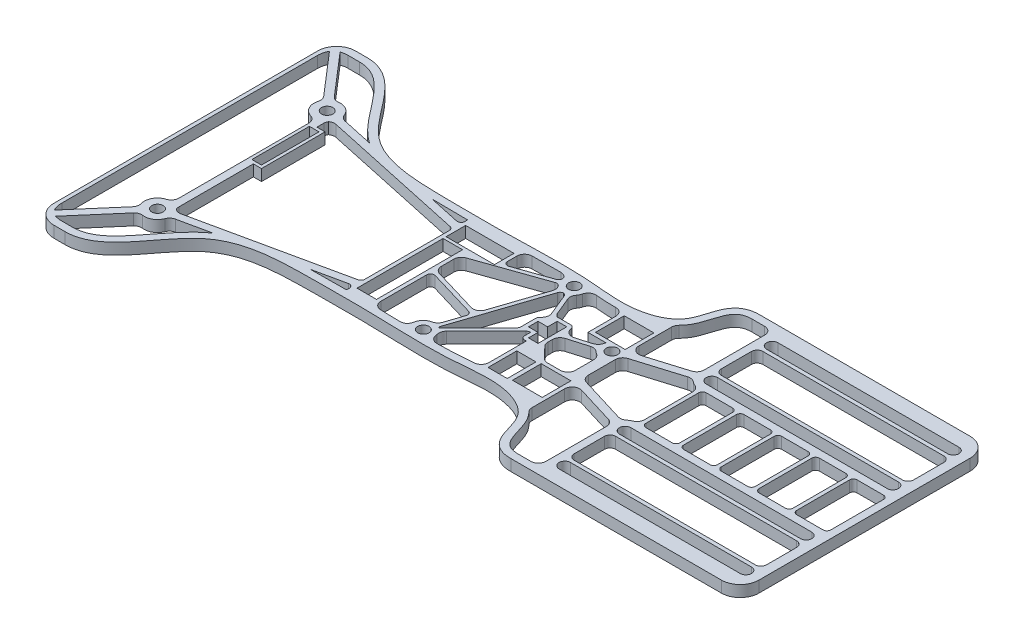
from build123d import *

# Parameters (mm, degrees)
SKETCH_1_W                = 180
SKETCH_1_H                = 150
EXTRUDE_5273_DEPTH        = 1.5
CUT_EXTRUDE_6960_DEPTH    = 118.192149908
CUT_EXTRUDE_8328_DEPTH    = 118.192149908
SKETCH_4_R                = 1.5
SKETCH_4_W                = 7.874
SKETCH_4_H                = 7.62
SKETCH_4_W_2              = 5.175
SKETCH_4_H_2              = 22.825
SKETCH_4_W_3              = 12.825
SKETCH_4_H_3              = 5.175
SKETCH_4_W_4              = 5.08
DMOTOR_DEPTH              = 118.192149908
SKETCH_5_R                = 1.5
SKETCH_5_W                = 2.55
SKETCH_5_H                = 15.25
LINELANCE_1_DEPTH         = 118.192149908
CUT_EXTRUDE_11814_DEPTH   = 118.192149908
CUT_EXTRUDE_1_DEPTH       = 99.534258137
CUT_EXTRUDE_2_DEPTH       = 99.534258137
CUT_EXTRUDE_2_DEPTH_BACK  = 99.534258137
CUT_EXTRUDE_START         = -3
CUT_EXTRUDE_3_OUTLINE_W   = 9
CUT_EXTRUDE_3_OUTLINE_H   = 16
CUT_EXTRUDE_3_OUTLINE_W_2 = 8.99992757
CUT_EXTRUDE_3_DEPTH       = 3
FILLET_START              = -1.5
FILLET_2_DEPTH            = 3
FILLET_START_2            = -2
FILLET_1_DEPTH            = 4
FILLET_1_2_DEPTH          = 3


with BuildPart() as part:
    # Эскиз1 → Extrude 5273 (new, symmetric)
    with BuildSketch(Plane(origin=(0, 0, 0), x_dir=(1, 0, 0), z_dir=(0, 1, 0))):
        Rectangle(SKETCH_1_W, SKETCH_1_H)
    extrude(amount=EXTRUDE_5273_DEPTH, both=True)

    # Эскиз2 → Cut-Extrude 6960 (cut, through all)
    with BuildSketch(Plane(origin=(0, 1.5, 0), x_dir=(1, 0, 0), z_dir=(0, 1, 0))):
        with BuildLine():
            ThreePointArc((86, 29), (87.5, 27.5), (86, 26))
            Line((86, 26), (38, 26))
            ThreePointArc((38, 26), (36.5, 27.5), (38, 29))
            Line((38, 29), (86, 29))
        make_face()
        with BuildLine():
            ThreePointArc((86, 13), (87.5, 11.5), (86, 10))
            Line((86, 10), (38, 10))
            ThreePointArc((38, 10), (36.5, 11.5), (38, 13))
            Line((38, 13), (86, 13))
        make_face()
        with BuildLine():
            ThreePointArc((38, -13), (36.5, -11.5), (38, -10))
            Line((38, -10), (86, -10))
            ThreePointArc((86, -10), (87.5, -11.5), (86, -13))
            Line((86, -13), (38, -13))
        make_face()
        with BuildLine():
            ThreePointArc((38, -29), (36.5, -27.5), (38, -26))
            Line((38, -26), (86, -26))
            ThreePointArc((86, -26), (87.5, -27.5), (86, -29))
            Line((86, -29), (38, -29))
        make_face()
        with BuildLine():
            ThreePointArc((36.5, 15.5), (38, 14), (39.5, 15.5))
            Line((39.5, 15.5), (39.5, 23.5))
            ThreePointArc((39.5, 23.5), (38, 25), (36.5, 23.5))
            Line((36.5, 23.5), (36.5, 15.5))
        make_face()
        with BuildLine():
            ThreePointArc((38, 25), (39.060660172, 24.560660172), (39.5, 23.5))
            Line((39.5, 23.5), (39.5, 15.5))
            ThreePointArc((39.5, 15.5), (39.060660172, 14.439339828), (38, 14))
            Line((38, 14), (86, 14))
            ThreePointArc((86, 14), (84.939339828, 14.439339828), (84.5, 15.5))
            Line((84.5, 15.5), (84.5, 23.5))
            ThreePointArc((84.5, 23.5), (84.939339828, 24.560660172), (86, 25))
            Line((86, 25), (38, 25))
        make_face()
        with BuildLine():
            ThreePointArc((84.5, 15.5), (86, 14), (87.5, 15.5))
            Line((87.5, 15.5), (87.5, 23.5))
            ThreePointArc((87.5, 23.5), (86, 25), (84.5, 23.5))
            Line((84.5, 23.5), (84.5, 15.5))
        make_face()
        with BuildLine():
            ThreePointArc((36.5, -15.5), (38, -14), (39.5, -15.5))
            Line((39.5, -15.5), (39.5, -23.5))
            ThreePointArc((39.5, -23.5), (38, -25), (36.5, -23.5))
            Line((36.5, -23.5), (36.5, -15.5))
        make_face()
        with BuildLine():
            Line((39.5, -15.5), (39.5, -23.5))
            ThreePointArc((39.5, -23.5), (39.060660172, -24.560660172), (38, -25))
            Line((38, -25), (86, -25))
            ThreePointArc((86, -25), (84.939339828, -24.560660172), (84.5, -23.5))
            Line((84.5, -23.5), (84.5, -15.5))
            ThreePointArc((84.5, -15.5), (84.939339828, -14.439339828), (86, -14))
            Line((86, -14), (38, -14))
            ThreePointArc((38, -14), (39.060660172, -14.439339828), (39.5, -15.5))
        make_face()
        with BuildLine():
            ThreePointArc((84.5, -15.5), (86, -14), (87.5, -15.5))
            Line((87.5, -15.5), (87.5, -23.5))
            ThreePointArc((87.5, -23.5), (86, -25), (84.5, -23.5))
            Line((84.5, -23.5), (84.5, -15.5))
        make_face()
    extrude(amount=-CUT_EXTRUDE_6960_DEPTH, mode=Mode.SUBTRACT)

    # Эскиз3 → Cut-Extrude 8328 (cut, through all)
    with BuildSketch(Plane(origin=(0, 1.5, 0), x_dir=(1, 0, 0), z_dir=(0, 1, 0))):
        with BuildLine():
            Line((27.5, 33), (85, 33))
            ThreePointArc((85, 33), (88.535533906, 31.535533906), (90, 28))
            Line((90, 28), (90, 75))
            Line((90, 75), (27.5, 75))
            Line((27.5, 75), (27.5, 33))
        make_face()
        with BuildLine():
            Line((90, -75), (90, -28))
            ThreePointArc((90, -28), (88.535533906, -31.535533906), (85, -33))
            Line((85, -33), (27.5, -33))
            Line((27.5, -33), (27.5, -75))
            Line((27.5, -75), (90, -75))
        make_face()
    extrude(amount=-CUT_EXTRUDE_8328_DEPTH, mode=Mode.SUBTRACT)

    # Эскиз4 → Вырез для DMotor (cut, through all)
    with BuildSketch(Plane(origin=(0, 1.5, 0), x_dir=(1, 0, 0), z_dir=(0, 1, 0))):
        with Locations(Location((-12, -15, 0), (0, 0, 270))):
            Circle(SKETCH_4_R)
        with Locations(Location((-2, 15, 0), (0, 0, 270))):
            Circle(SKETCH_4_R)
        with Locations(Location((18, 5, 0), (0, 0, 270))):
            Circle(SKETCH_4_R)
        with Locations((15.378, 11)):
            Rectangle(SKETCH_4_W, SKETCH_4_H)
        with Locations((15.378, -11)):
            Rectangle(SKETCH_4_W, SKETCH_4_H)
        Polygon((3.83, -0.43), (3.83, -2.97), (6.37, -2.97), (6.37, 4.65), (3.83, 4.65), (3.83, 2.11), (1.29, 2.11), (1.29, -0.43), align=None)
        with Locations((-27.7375, -2.8625)):
            Rectangle(SKETCH_4_W_2, SKETCH_4_H_2)
        with Locations((-23.9125, 11.9375)):
            Rectangle(SKETCH_4_W_3, SKETCH_4_H_3)
        with Locations((7.8, -11.3)):
            Rectangle(SKETCH_4_W_4, SKETCH_4_H)
    extrude(amount=-DMOTOR_DEPTH, mode=Mode.SUBTRACT)

    # Эскиз5 → Вырез для Linelance (1 плата) (cut, through all)
    with BuildSketch(Plane(origin=(0, 1.5, 0), x_dir=(1, 0, 0), z_dir=(0, 1, 0))):
        with Locations(Location((-75, 22.5, 0), (0, 0, 270))):
            Circle(SKETCH_5_R)
        with Locations(Location((-75, -22.5, 0), (0, 0, 270))):
            Circle(SKETCH_5_R)
        with Locations((-72.525, 8.95)):
            Rectangle(SKETCH_5_W, SKETCH_5_H)
    extrude(amount=-LINELANCE_1_DEPTH, mode=Mode.SUBTRACT)

    # Эскиз6 → Cut-Extrude 11814 (cut, through all)
    with BuildSketch(Plane(origin=(0, 1.5, 0), x_dir=(1, 0, 0), z_dir=(0, 1, 0))):
        with BuildLine():
            ThreePointArc((-90, 35), (-88.535533906, 38.535533906), (-85, 40))
            Line((-85, 40), (-82, 40))
            add(Edge.make_bspline(
                [(29.174696317, 33), (25.174443353, 33), (22.263039953, 29.095708265), (20.959201373, 21.044231044), (11.178424533, 16.661826251), (-2.912295004, 18.89849361), (-20.904097143, 17.963451349), (-40.921477826, 18.08537112), (-65.587592727, 18.693161196), (-72.397497435, 40), (-82, 40)],
                knots=[0, 0, 0, 0, 0.064919912, 0.117356941, 0.18302612, 0.292534606, 0.460869964, 0.611104745, 0.786597446, 1, 1, 1, 1], degree=3))
            Line((29.174696317, 33), (27.5, 33))
            Line((27.5, 33), (27.5, 75))
            Line((27.5, 75), (-90, 75))
            Line((-90, 75), (-90, 35))
        make_face()
        with BuildLine():
            ThreePointArc((-85, -40), (-88.535533906, -38.535533906), (-90, -35))
            Line((-90, -35), (-90, -75))
            Line((-90, -75), (27.5, -75))
            Line((27.5, -75), (27.5, -33))
            Line((27.5, -33), (29.174696317, -33))
            add(Edge.make_bspline(
                [(29.174696317, -33), (25.174443353, -33), (22.263039953, -29.095708265), (20.959201373, -21.044231044), (11.178424533, -16.661826251), (-2.912295004, -18.89849361), (-20.904097143, -17.963451349), (-40.921477826, -18.08537112), (-65.587592727, -18.693161196), (-72.397497435, -40), (-82, -40)],
                knots=[0, 0, 0, 0, 0.064919912, 0.117356941, 0.18302612, 0.292534606, 0.460869964, 0.611104745, 0.786597446, 1, 1, 1, 1], degree=3))
            Line((-82, -40), (-85, -40))
        make_face()
    extrude(amount=-CUT_EXTRUDE_11814_DEPTH, mode=Mode.SUBTRACT)

    # Эскиз7 → Вырез Облегчение 1 (cut, through all)
    with BuildSketch(Plane(origin=(0, 1.5, 0), x_dir=(1, 0, 0), z_dir=(0, 1, 0))):
        with BuildLine():
            Line((-8.902902115, -4.127567514), (-3.409755996, 12.351870843))
            ThreePointArc((-3.409755996, 12.351870843), (-4.102961295, 12.86047814), (-4.623439876, 13.544815057))
            Line((-4.623439876, 13.544815057), (-24.15, 6.659829298))
            Line((-24.15, 6.659829298), (-24.15, 0.426205922))
            Line((-24.15, 0.426205922), (-8.902902115, -4.127567514))
        make_face()
        with BuildLine():
            ThreePointArc((-1.336169855, 12.074366814), (-1.896788918, 12.001775947), (-2.461072698, 12.035643077))
            Line((-2.461072698, 12.035643077), (-10.590244004, -12.351870843))
            ThreePointArc((-10.590244004, -12.351870843), (-10.423209581, -12.447798602), (-10.262675499, -12.55424785))
            Line((-10.262675499, -12.55424785), (0.854549467, -1.43))
            Line((0.854549467, -1.43), (0.29, -1.43))
            Line((0.29, -1.43), (0.29, 3.11))
            Line((0.29, 3.11), (2.354667611, 3.11))
            Line((2.354667611, 3.11), (-1.336169855, 12.074366814))
        make_face()
        with BuildLine():
            Line((-11.538927302, -12.035643077), (-9.219287024, -5.076722242))
            Line((-9.219287024, -5.076722242), (-24.15, -0.617441883))
            Line((-24.15, -0.617441883), (-24.15, -15.275))
            Line((-24.15, -15.275), (-24.15, -16.092669036))
            add(Edge.make_bspline(
                [(-14.694642159, -16.318674955), (-15.987976916, -16.286222999), (-17.282914752, -16.248857872), (-19.874602584, -16.178155779), (-21.172389147, -16.145214053), (-23.028062557, -16.109985236), (-23.589238986, -16.100684905), (-24.15, -16.092669036)],
                knots=[0.406288882, 0.406288882, 0.406288882, 0.406288882, 0.4375, 0.4375, 0.46875, 0.46875, 0.482323343, 0.482323343, 0.482323343, 0.482323343], degree=3))
            ThreePointArc((-14.694642159, -16.318674955), (-14.415222278, -13.220477213), (-11.538927302, -12.035643077))
        make_face()
        with BuildLine():
            Line((-16.5, 10.417529619), (-4.955970451, 14.487907532))
            ThreePointArc((-4.955970451, 14.487907532), (-4.967263088, 15.441983898), (-4.678404128, 16.351351666))
            add(Edge.make_bspline(
                [(-4.678404128, 16.351351666), (-6.710548792, 16.414052135), (-8.756959257, 16.419356666), (-12.702430937, 16.371539821), (-14.600242226, 16.323034836), (-16.5, 16.270908805)],
                knots=[0.325241822, 0.325241822, 0.325241822, 0.325241822, 0.375, 0.375, 0.420804199, 0.420804199, 0.420804199, 0.420804199], degree=3))
            Line((-16.5, 16.270908805), (-16.5, 10.417529619))
        make_face()
        with BuildLine():
            ThreePointArc((0.820607877, 16.021846958), (0.835587409, 14.020487854), (-0.411478233, 12.455083774))
            Line((-0.411478233, 12.455083774), (2.83, 4.582128066))
            Line((2.83, 4.582128066), (2.83, 5.65))
            Line((2.83, 5.65), (7.37, 5.65))
            Line((7.37, 5.65), (7.37, 2.40036778))
            Line((7.37, 2.40036778), (15.020899439, 4.646503395))
            ThreePointArc((15.020899439, 4.646503395), (15.031433787, 5.433145055), (15.24611184, 6.19))
            Line((15.24611184, 6.19), (10.441, 6.19))
            Line((10.441, 6.19), (10.441, 15.704216945))
            add(Edge.make_bspline(
                [(10.441, 15.704216945), (9.847440479, 15.650577839), (9.258926549, 15.617782688), (7.286699457, 15.56254878), (5.928184506, 15.616617616), (3.314166167, 15.793575688), (2.056408073, 15.913942833), (0.820607877, 16.021846958)],
                knots=[0.205634931, 0.205634931, 0.205634931, 0.205634931, 0.21875, 0.21875, 0.25, 0.25, 0.280150338, 0.280150338, 0.280150338, 0.280150338], degree=3))
        make_face()
        with BuildLine():
            Line((2.268316694, -1.43), (-9.55534548, -13.261131323))
            ThreePointArc((-9.55534548, -13.261131323), (-9.006356142, -14.804816877), (-9.350255806, -16.406718062))
            add(Edge.make_bspline(
                [(4.26, -15.730331198), (3.046650052, -15.81800323), (1.85624768, -15.932163665), (0.045867473, -16.089018669), (-0.58554622, -16.14019059), (-1.850323322, -16.226139926), (-2.484465556, -16.261956101), (-5.182608062, -16.387077569), (-7.261528853, -16.415920139), (-9.350255806, -16.406718062)],
                knots=[0.252649256, 0.252649256, 0.252649256, 0.252649256, 0.28125, 0.28125, 0.296875, 0.296875, 0.3125, 0.3125, 0.363192451, 0.363192451, 0.363192451, 0.363192451], degree=3))
            Line((4.26, -15.730331198), (4.26, -3.97))
            Line((4.26, -3.97), (2.83, -3.97))
            Line((2.83, -3.97), (2.83, -1.43))
            Line((2.83, -1.43), (2.268316694, -1.43))
        make_face()
        with BuildLine():
            Line((15.302589144, 3.68699784), (7.37, 1.35816433))
            Line((7.37, 1.35816433), (7.37, -2.138171498))
            Line((7.37, -2.138171498), (11.244941037, -6.19))
            Line((11.244941037, -6.19), (17.5, -6.19))
            Line((17.5, -6.19), (17.5, 2.041960108))
            ThreePointArc((17.5, 2.041960108), (16.202113371, 2.598416425), (15.302589144, 3.68699784))
        make_face()
    extrude(amount=-CUT_EXTRUDE_1_DEPTH, mode=Mode.SUBTRACT)

    # Эскиз8 → Вырез Облегчение 2 (cut, two sides: drawn at the far end of the back side and taken through both)
    with BuildSketch(Plane(origin=(0, 1.5, 0), x_dir=(1, 0, 0), z_dir=(0, 1, 0)).offset(-CUT_EXTRUDE_2_DEPTH_BACK)):
        with BuildLine():
            Line((-77.947620139, 24.387203093), (-88.348692952, 36.450067967))
            add(Edge.make_bspline(
                [(-88.348692952, 36.450067967), (-88.827002005, 35.691045731), (-89, 34.72242084), (-89, 33.87087738)],
                knots=[0.590841693, 0.590841693, 0.590841693, 0.590841693, 1, 1, 1, 1], degree=3))
            Line((-89, 33.87087738), (-89, -33.87087738))
            add(Edge.make_bspline(
                [(-88.348692952, -36.450067967), (-88.827002005, -35.691045731), (-89, -34.72242084), (-89, -33.87087738)],
                knots=[0.590841693, 0.590841693, 0.590841693, 0.590841693, 1, 1, 1, 1], degree=3))
            Line((-88.348692952, -36.450067967), (-77.947620139, -24.387203093))
            ThreePointArc((-77.947620139, -24.387203093), (-77.969249478, -20.647013886), (-74.6, -19.02293227))
            Line((-74.6, -19.02293227), (-74.6, 0.525))
            Line((-74.6, 0.525), (-74.6, 17.375))
            Line((-74.6, 17.375), (-74.6, 19.02293227))
            ThreePointArc((-74.6, 19.02293227), (-77.969249478, 20.647013886), (-77.947620139, 24.387203093))
        make_face()
        with BuildLine():
            Line((-82, 38), (-85, 38))
            add(Edge.make_bspline(
                [(-85, 38), (-85.578551553, 38), (-86.212596727, 37.914976024), (-86.785928943, 37.700343056)],
                knots=[0, 0, 0, 0, 0.278533483, 0.278533483, 0.278533483, 0.278533483], degree=3))
            Line((-86.785928943, 37.700343056), (-76.432927609, 25.693230099))
            ThreePointArc((-76.432927609, 25.693230099), (-73.212613228, 25.509194), (-71.510380273, 22.769358793))
            Line((-71.510380273, 22.769358793), (-62.01539201, 20.71859941))
            add(Edge.make_bspline(
                [(-62.01539201, 20.71859941), (-62.312136319, 20.922340424), (-63.552524996, 21.82545214), (-65.753815363, 23.87699973), (-68.341357966, 26.999146771), (-70.903261541, 30.394035056), (-73.425353703, 33.508894567), (-75.596058184, 35.586474955), (-77.408019321, 36.801708706), (-78.818674032, 37.473812911), (-80.070803513, 37.826159231), (-81.137712844, 37.974009981), (-81.716026986, 38), (-82, 38)],
                knots=[0.779306781, 0.779306781, 0.779306781, 0.779306781, 0.787119281, 0.8125, 0.84375, 0.875, 0.90625, 0.9375, 0.953125, 0.96875, 0.984375, 0.9921875, 1, 1, 1, 1], degree=3))
        make_face()
        with BuildLine():
            add(Edge.make_bspline(
                [(-31.325, 16.053738691), (-31.973588223, 16.0553776), (-33.273320455, 16.061026874), (-35.768428528, 16.080080512), (-38.290757977, 16.113699253), (-40.18360806, 16.138383365), (-40.859290556, 16.149233724)],
                knots=[0.540183636, 0.540183636, 0.540183636, 0.540183636, 0.555808636, 0.571433636, 0.599869411, 0.615494411, 0.615494411, 0.615494411, 0.615494411], degree=3))
            Line((-40.859290556, 16.149233724), (-31.325, 14.0899857))
            Line((-31.325, 14.0899857), (-31.325, 16.053738691))
        make_face()
        with BuildLine():
            Line((-31.325, 12.04386859), (-71.932610945, 20.814436478))
            ThreePointArc((-71.932610945, 20.814436478), (-72.232539068, 20.35730077), (-72.6, 19.952452159))
            Line((-72.6, 19.952452159), (-72.6, 17.375))
            Line((-72.6, 17.375), (-70.45, 17.375))
            Line((-70.45, 17.375), (-70.45, 0.525))
            Line((-70.45, 0.525), (-72.6, 0.525))
            Line((-72.6, 0.525), (-72.6, -19.952452159))
            ThreePointArc((-72.6, -19.952452159), (-72.232539068, -20.35730077), (-71.932610945, -20.814436478))
            Line((-71.932610945, -20.814436478), (-31.325, -12.04386859))
            Line((-31.325, -12.04386859), (-31.325, 9.35))
            Line((-31.325, 9.35), (-31.325, 12.04386859))
        make_face()
        with BuildLine():
            Line((-31.325, -16.053738691), (-31.325, -14.0899857))
            Line((-31.325, -14.0899857), (-40.839484946, -16.144956042))
            add(Edge.make_bspline(
                [(-40.839484946, -16.144956042), (-38.940210271, -16.108656148), (-36.415633033, -16.081672277), (-33.273355772, -16.060812735), (-31.973588223, -16.0553776), (-31.325, -16.053738691)],
                knots=[0.384661935, 0.384661935, 0.384661935, 0.384661935, 0.428566364, 0.444191364, 0.459816364, 0.459816364, 0.459816364, 0.459816364], degree=3))
        make_face()
        with BuildLine():
            Line((-76.432927609, -25.693230099), (-86.785928943, -37.700343056))
            add(Edge.make_bspline(
                [(-85, -38), (-85.578551553, -38), (-86.212596727, -37.914976024), (-86.785928943, -37.700343056)],
                knots=[0, 0, 0, 0, 0.278533483, 0.278533483, 0.278533483, 0.278533483], degree=3))
            Line((-85, -38), (-82, -38))
            add(Edge.make_bspline(
                [(-82, -38), (-81.716026986, -38), (-81.137712844, -37.974009981), (-80.070803513, -37.826159231), (-78.818674032, -37.473812911), (-77.408019321, -36.801708706), (-75.596058184, -35.586474955), (-73.425353703, -33.508894567), (-70.903261541, -30.394035056), (-68.341357966, -26.999146771), (-65.581001419, -23.668481214), (-63.338944412, -21.643860829), (-62.090270681, -20.769502271), (-62.01692329, -20.718930141)],
                knots=[0, 0, 0, 0, 0.0078125, 0.015625, 0.03125, 0.046875, 0.0625, 0.09375, 0.125, 0.15625, 0.1875, 0.21875, 0.220691417, 0.220691417, 0.220691417, 0.220691417], degree=3))
            Line((-62.01692329, -20.718930141), (-71.510380273, -22.769358793))
            ThreePointArc((-71.510380273, -22.769358793), (-73.212613228, -25.509194), (-76.432927609, -25.693230099))
        make_face()
    extrude(amount=CUT_EXTRUDE_2_DEPTH + CUT_EXTRUDE_2_DEPTH_BACK, mode=Mode.SUBTRACT)

    # Вырез Облегчение 3: read off the stored shape, not the designer's step
    # Вырез Облегчение 3 outline → Вырез Облегчение 3 (cut)
    with BuildSketch(Plane(origin=(0, 1.5, 0), x_dir=(1, 0, 0), z_dir=(0, 1, 0)).offset(CUT_EXTRUDE_START)):
        with BuildLine():
            Line((34.5, 31), (29.174696317, 31))
            add(Edge.make_bspline(
                [(29.174696317, 31), (28.98775742, 31), (28.599257263, 30.987174449), (27.941662357, 30.91659028), (27.250669887, 30.756660646), (26.610801973, 30.483558598), (25.921716072, 30.028926225), (25.227795843, 29.253337215), (24.529923724, 27.881538168), (23.965489201, 26.15805125), (23.385302974, 24.188879646), (22.603071914, 22.125963554), (21.570798441, 20.604382057), (20.757749622, 19.754217243), (20.464825213, 19.484118809), (20.315, 19.353827366)],
                knots=[0, 0, 0, 0, 0.00390625, 0.0078125, 0.015625, 0.0234375, 0.03125, 0.046875, 0.0625, 0.078125, 0.09375, 0.109375, 0.124446187, 0.128352437, 0.132258687, 0.132258687, 0.132258687, 0.132258687], degree=3))
            Line((20.315, 19.353827366), (20.315, 7.148749494))
            Line((20.315, 7.148749494), (34.50007243, 11.477483286))
            ThreePointArc((34.50007243, 11.477483286), (34.500018107, 11.488741585), (34.5, 11.5))
            Line((34.5, 11.5), (34.5, 31))
        make_face()
        with BuildLine():
            Line((20.315, -7.148749494), (20.315, -19.353827366))
            add(Edge.make_bspline(
                [(20.315, -19.353827366), (20.464825213, -19.484118809), (20.757749622, -19.754217243), (21.570798441, -20.604382057), (22.603071914, -22.125963554), (23.385302974, -24.188879646), (23.965489201, -26.15805125), (24.529923724, -27.881538168), (25.227795843, -29.253337215), (25.921716072, -30.028926225), (26.610801973, -30.483558598), (27.250669887, -30.756660646), (27.941662357, -30.91659028), (28.599257263, -30.987174449), (28.98775742, -31), (29.174696317, -31)],
                knots=[0.867741313, 0.867741313, 0.867741313, 0.867741313, 0.871647563, 0.875553813, 0.890625, 0.90625, 0.921875, 0.9375, 0.953125, 0.96875, 0.9765625, 0.984375, 0.9921875, 0.99609375, 1, 1, 1, 1], degree=3))
            Line((29.174696317, -31), (34.5, -31))
            Line((34.5, -31), (34.5, -11.5))
            ThreePointArc((34.5, -11.5), (34.500018107, -11.488741585), (34.50007243, -11.477483286))
            Line((34.50007243, -11.477483286), (20.315, -7.148749494))
        make_face()
        with BuildLine():
            ThreePointArc((38, 8), (36.345310742, 8.415846395), (35.08381952, 9.564569452))
            Line((35.08381952, 9.564569452), (20.315, 5.057698695))
            Line((20.315, 5.057698695), (20.315, -5.057698695))
            Line((20.315, -5.057698695), (35.08381952, -9.564569452))
            ThreePointArc((35.08381952, -9.564569452), (36.345310742, -8.415846395), (38, -8))
            Line((38, -8), (38, 8))
        make_face()
        with Locations((73.50007243, 0)):
            Rectangle(CUT_EXTRUDE_3_OUTLINE_W, CUT_EXTRUDE_3_OUTLINE_H)
        with Locations((63.50007243, 0)):
            Rectangle(CUT_EXTRUDE_3_OUTLINE_W, CUT_EXTRUDE_3_OUTLINE_H)
        with Locations((53.50007243, 0)):
            Rectangle(CUT_EXTRUDE_3_OUTLINE_W, CUT_EXTRUDE_3_OUTLINE_H)
        with Locations((83.500036215, 0)):
            Rectangle(CUT_EXTRUDE_3_OUTLINE_W_2, CUT_EXTRUDE_3_OUTLINE_H)
        with Locations((43.50007243, 0)):
            Rectangle(CUT_EXTRUDE_3_OUTLINE_W, CUT_EXTRUDE_3_OUTLINE_H)
    extrude(amount=CUT_EXTRUDE_3_DEPTH, mode=Mode.SUBTRACT)

    # Скругление 2мм: read off the stored shape, not the designer's step
    # Скругление 2мм outline → Скругление 2мм (add)
    with BuildSketch(Plane(origin=(0, 0, 0), x_dir=(1, 0, 0), z_dir=(0, 1, 0)).offset(FILLET_START)):
        with BuildLine():
            ThreePointArc((34.5, -29), (33.914213562, -30.414213562), (32.5, -31))
            Line((32.5, -31), (34.5, -31))
            Line((34.5, -31), (34.5, -29))
        make_face()
        with BuildLine():
            ThreePointArc((33.08374709, -11.045275739), (34.107403835, -11.768125326), (34.5, -12.958189572))
            Line((34.5, -12.958189572), (34.5, -11.5))
            ThreePointArc((34.5, -11.5), (34.500018107, -11.488741585), (34.50007243, -11.477483286))
            Line((34.50007243, -11.477483286), (33.08374709, -11.045275739))
        make_face()
        with BuildLine():
            add(Edge.make_bspline(
                [(20.315, -19.353827366), (20.464825213, -19.484118809), (20.656715783, -19.66105641), (20.842019437, -19.846640346), (20.885497049, -19.891073634)],
                knots=[0.867741313, 0.867741313, 0.867741313, 0.867741313, 0.871647563, 0.87285917, 0.87285917, 0.87285917, 0.87285917], degree=3))
            ThreePointArc((20.885497049, -19.891073634), (20.463108278, -19.247629124), (20.315, -18.492316574))
            Line((20.315, -18.492316574), (20.315, -19.353827366))
        make_face()
        with BuildLine():
            ThreePointArc((20.315, -9.850122702), (21.124935754, -8.242718867), (22.89874709, -7.937208869))
            Line((22.89874709, -7.937208869), (20.315, -7.148749494))
            Line((20.315, -7.148749494), (20.315, -9.850122702))
        make_face()
        with BuildLine():
            ThreePointArc((32.5, 31), (33.914213562, 30.414213562), (34.5, 29))
            Line((34.5, 29), (34.5, 31))
            Line((34.5, 31), (32.5, 31))
        make_face()
        with BuildLine():
            Line((34.5, 11.5), (34.5, 12.958189572))
            ThreePointArc((34.5, 12.958189572), (34.107403835, 11.768125326), (33.08374709, 11.045275739))
            Line((33.08374709, 11.045275739), (34.50007243, 11.477483286))
            ThreePointArc((34.50007243, 11.477483286), (34.500018107, 11.488741585), (34.5, 11.5))
        make_face()
        with BuildLine():
            ThreePointArc((20.315, 18.492316574), (20.463108278, 19.247629124), (20.885497049, 19.891073634))
            add(Edge.make_bspline(
                [(20.885497049, 19.891073634), (20.842019437, 19.846640346), (20.656715783, 19.66105641), (20.464825213, 19.484118809), (20.315, 19.353827366)],
                knots=[0.12714083, 0.12714083, 0.12714083, 0.12714083, 0.128352437, 0.132258687, 0.132258687, 0.132258687, 0.132258687], degree=3))
            Line((20.315, 19.353827366), (20.315, 18.492316574))
        make_face()
        with BuildLine():
            Line((20.315, 7.148749494), (22.89874709, 7.937208869))
            ThreePointArc((22.89874709, 7.937208869), (21.124935754, 8.242718867), (20.315, 9.850122702))
            Line((20.315, 9.850122702), (20.315, 7.148749494))
        make_face()
        with BuildLine():
            Line((20.315, 5.057698695), (20.315, 3.576970306))
            ThreePointArc((20.315, 3.576970306), (20.707596165, 4.767034552), (21.73125291, 5.489884139))
            Line((21.73125291, 5.489884139), (20.315, 5.057698695))
        make_face()
        with BuildLine():
            ThreePointArc((21.73125291, -5.489884139), (20.707596165, -4.767034552), (20.315, -3.576970306))
            Line((20.315, -3.576970306), (20.315, -5.057698695))
            Line((20.315, -5.057698695), (21.73125291, -5.489884139))
        make_face()
        with BuildLine():
            Line((35.08381952, 9.564569452), (33.882825012, 9.198072521))
            ThreePointArc((33.882825012, 9.198072521), (34.865375652, 9.244994326), (35.751454974, 8.817828256))
            ThreePointArc((35.751454974, 8.817828256), (35.390784986, 9.167191177), (35.08381952, 9.564569452))
        make_face()
        with BuildLine():
            ThreePointArc((35.751454974, -8.817828256), (34.865375652, -9.244994326), (33.882825012, -9.198072521))
            Line((33.882825012, -9.198072521), (35.08381952, -9.564569452))
            ThreePointArc((35.08381952, -9.564569452), (35.390784986, -9.167191177), (35.751454974, -8.817828256))
        make_face()
        with BuildLine():
            ThreePointArc((38, 8), (37.352481645, 8.060418633), (36.727318819, 8.239588583))
            ThreePointArc((36.727318819, 8.239588583), (37.651510103, 7.504660167), (38.00007243, 6.376496344))
            Line((38.00007243, 6.376496344), (38, 8))
        make_face()
        with BuildLine():
            ThreePointArc((38.00007243, -6.376496344), (37.651510103, -7.504660167), (36.727318819, -8.239588583))
            ThreePointArc((36.727318819, -8.239588583), (37.352481645, -8.060418633), (38, -8))
            Line((38, -8), (38.00007243, -6.376496344))
        make_face()
        with BuildLine():
            Line((7.37, 2.40036778), (9.933379409, 3.152919533))
            ThreePointArc((9.933379409, 3.152919533), (8.171408915, 3.470874927), (7.37, 5.071930643))
            Line((7.37, 5.071930643), (7.37, 2.40036778))
        make_face()
        with BuildLine():
            ThreePointArc((15.084596886, 5.707407013), (14.588401245, 4.798789021), (13.704374218, 4.260000578))
            Line((13.704374218, 4.260000578), (15.020899439, 4.646503395))
            ThreePointArc((15.020899439, 4.646503395), (15.005392761, 5.179798458), (15.084596886, 5.707407013))
        make_face()
        with BuildLine():
            ThreePointArc((16.5, 2.401923789), (17.232050808, 1.669872981), (17.5, 0.669872981))
            Line((17.5, 0.669872981), (17.5, 2.041960108))
            ThreePointArc((17.5, 2.041960108), (16.983932353, 2.177305093), (16.5, 2.401923789))
        make_face()
        with BuildLine():
            Line((17.5, -6.19), (17.5, -4.19))
            ThreePointArc((17.5, -4.19), (16.914213562, -5.604213562), (15.5, -6.19))
            Line((15.5, -6.19), (17.5, -6.19))
        make_face()
        with BuildLine():
            ThreePointArc((13.986063923, 3.300495023), (15.021048007, 3.325085989), (15.929665999, 2.828890347))
            ThreePointArc((15.929665999, 2.828890347), (15.577824352, 3.229953355), (15.302589144, 3.68699784))
            Line((15.302589144, 3.68699784), (13.986063923, 3.300495023))
        make_face()
        with BuildLine():
            Line((11.244941037, -6.19), (12.099630152, -6.19))
            ThreePointArc((12.099630152, -6.19), (11.313698202, -6.029106025), (10.654217968, -5.57231097))
            Line((10.654217968, -5.57231097), (11.244941037, -6.19))
        make_face()
        with BuildLine():
            ThreePointArc((7.37, -0.139086607), (7.768944283, 1.059504479), (8.806620591, 1.779924504))
            Line((8.806620591, 1.779924504), (7.37, 1.35816433))
            Line((7.37, 1.35816433), (7.37, -0.139086607))
        make_face()
        with BuildLine():
            Line((7.37, -2.138171498), (7.924587816, -2.718075733))
            ThreePointArc((7.924587816, -2.718075733), (7.513817847, -2.080471293), (7.37, -1.335764763))
            Line((7.37, -1.335764763), (7.37, -2.138171498))
        make_face()
        with BuildLine():
            ThreePointArc((-78.767589776, 25.338180277), (-78.328169296, 24.458113769), (-78.361452376, 23.475006627))
            ThreePointArc((-78.361452376, 23.475006627), (-78.187338168, 23.945985961), (-77.947620139, 24.387203093))
            Line((-77.947620139, 24.387203093), (-78.767589776, 25.338180277))
        make_face()
        with BuildLine():
            ThreePointArc((-76.018181818, 19.151372552), (-74.993196284, 18.428745546), (-74.6, 17.237871153))
            Line((-74.6, 17.237871153), (-74.6, 19.02293227))
            ThreePointArc((-74.6, 19.02293227), (-75.315691965, 19.014266421), (-76.018181818, 19.151372552))
        make_face()
        with BuildLine():
            ThreePointArc((-74.6, -17.237871153), (-74.993196284, -18.428745546), (-76.018181818, -19.151372552))
            ThreePointArc((-76.018181818, -19.151372552), (-75.315691965, -19.014266421), (-74.6, -19.02293227))
            Line((-74.6, -19.02293227), (-74.6, -17.237871153))
        make_face()
        with BuildLine():
            ThreePointArc((-77.947620139, -24.387203093), (-78.187338168, -23.945985961), (-78.361452376, -23.475006627))
            ThreePointArc((-78.361452376, -23.475006627), (-78.328169296, -24.458113769), (-78.767589776, -25.338180277))
            Line((-78.767589776, -25.338180277), (-77.947620139, -24.387203093))
        make_face()
        with BuildLine():
            ThreePointArc((-70.705242037, -20.549345228), (-71.563307622, -20.54635732), (-72.341148478, -20.184074173))
            ThreePointArc((-72.341148478, -20.184074173), (-72.53420487, -19.70877453), (-72.6, -19.2))
            Line((-72.6, -19.2), (-72.6, -19.952452159))
            ThreePointArc((-72.6, -19.952452159), (-72.232539068, -20.35730077), (-71.932610945, -20.814436478))
            Line((-71.932610945, -20.814436478), (-70.705242037, -20.549345228))
        make_face()
        with BuildLine():
            ThreePointArc((-72.341148478, 20.184074173), (-71.563307622, 20.54635732), (-70.705242037, 20.549345228))
            Line((-70.705242037, 20.549345228), (-71.932610945, 20.814436478))
            ThreePointArc((-71.932610945, 20.814436478), (-72.232539068, 20.35730077), (-72.6, 19.952452159))
            Line((-72.6, 19.952452159), (-72.6, 19.2))
            ThreePointArc((-72.6, 19.2), (-72.53420487, 19.70877453), (-72.341148478, 20.184074173))
        make_face()
        with BuildLine():
            ThreePointArc((-77.252897246, -26.644207283), (-76.447069835, -26.080071129), (-75.469766637, -25.968330911))
            ThreePointArc((-75.469766637, -25.968330911), (-75.961239545, -25.865415062), (-76.432927609, -25.693230099))
            Line((-76.432927609, -25.693230099), (-77.252897246, -26.644207283))
        make_face()
        with BuildLine():
            ThreePointArc((-71.729587713, -23.746757183), (-71.163914819, -22.942007785), (-70.283011364, -22.504267543))
            Line((-70.283011364, -22.504267543), (-71.510380273, -22.769358793))
            ThreePointArc((-71.510380273, -22.769358793), (-71.584837469, -23.265940526), (-71.729587713, -23.746757183))
        make_face()
        with BuildLine():
            ThreePointArc((-70.283011364, 22.504267543), (-71.163914819, 22.942007785), (-71.729587713, 23.746757183))
            ThreePointArc((-71.729587713, 23.746757183), (-71.584837469, 23.265940526), (-71.510380273, 22.769358793))
            Line((-71.510380273, 22.769358793), (-70.283011364, 22.504267543))
        make_face()
        with BuildLine():
            ThreePointArc((-75.469766637, 25.968330911), (-76.447069835, 26.080071129), (-77.252897246, 26.644207283))
            Line((-77.252897246, 26.644207283), (-76.432927609, 25.693230099))
            ThreePointArc((-76.432927609, 25.693230099), (-75.961239545, 25.865415062), (-75.469766637, 25.968330911))
        make_face()
        with BuildLine():
            Line((2.83, 4.582128066), (2.83, 5.65))
            ThreePointArc((2.83, 5.65), (2.333145005, 6.063017576), (1.993890185, 6.612885353))
            Line((1.993890185, 6.612885353), (2.83, 4.582128066))
        make_face()
        with BuildLine():
            add(Edge.make_bspline(
                [(10.441, 15.704216945), (9.847440479, 15.650577839), (9.258926549, 15.617782688), (8.58451548, 15.598895229), (8.493261079, 15.596738202), (8.402138744, 15.594967303)],
                knots=[0.205634931, 0.205634931, 0.205634931, 0.205634931, 0.21875, 0.21875, 0.220805747, 0.220805747, 0.220805747, 0.220805747], degree=3))
            ThreePointArc((8.402138744, 15.594967303), (9.841406635, 15.023231878), (10.441, 13.595344888))
            Line((10.441, 13.595344888), (10.441, 15.704216945))
        make_face()
        with BuildLine():
            ThreePointArc((0.820607877, 16.021846958), (0.995271972, 15.168362142), (0.917353476, 14.300679836))
            ThreePointArc((0.917353476, 14.300679836), (1.691005279, 15.455630244), (3.030502131, 15.827377121))
            add(Edge.make_bspline(
                [(3.030502131, 15.827377121), (2.285704299, 15.890254752), (1.549338419, 15.958217715), (0.820607877, 16.021846958)],
                knots=[0.262371192, 0.262371192, 0.262371192, 0.262371192, 0.280150338, 0.280150338, 0.280150338, 0.280150338], degree=3))
        make_face()
        with BuildLine():
            Line((-0.411478233, 12.455083774), (0.110898607, 11.186326303))
            ThreePointArc((0.110898607, 11.186326303), (-0.02204798, 12.213030727), (0.376169111, 13.168656134))
            ThreePointArc((0.376169111, 13.168656134), (0.014197065, 12.776711853), (-0.411478233, 12.455083774))
        make_face()
        with BuildLine():
            Line((0.854549467, -1.43), (0.29, -1.43))
            ThreePointArc((0.29, -1.43), (0.09905577, -2.041031999), (-0.275168516, -2.560431639))
            Line((-0.275168516, -2.560431639), (0.854549467, -1.43))
        make_face()
        with BuildLine():
            Line((-8.902902115, -4.127567514), (-8.290073293, -2.28908105))
            ThreePointArc((-8.290073293, -2.28908105), (-9.264933445, -3.431162601), (-10.759788012, -3.572980816))
            Line((-10.759788012, -3.572980816), (-8.902902115, -4.127567514))
        make_face()
        with BuildLine():
            ThreePointArc((-4.244608783, 13.00959014), (-3.7816192, 12.083610974), (-3.843648043, 11.050194702))
            Line((-3.843648043, 11.050194702), (-3.409755996, 12.351870843))
            ThreePointArc((-3.409755996, 12.351870843), (-3.85654091, 12.643465289), (-4.244608783, 13.00959014))
        make_face()
        with BuildLine():
            Line((-24.15, 0.426205922), (-22.722348123, -0.000183627))
            ThreePointArc((-22.722348123, -0.000183627), (-23.753854146, 0.721327799), (-24.15, 1.916171671))
            Line((-24.15, 1.916171671), (-24.15, 0.426205922))
        make_face()
        with BuildLine():
            Line((-24.15, 6.659829298), (-24.15, 5.244338362))
            ThreePointArc((-24.15, 5.244338362), (-23.782501501, 6.3997339), (-22.81506115, 7.130523312))
            Line((-22.81506115, 7.130523312), (-24.15, 6.659829298))
        make_face()
        with BuildLine():
            ThreePointArc((1.294755065, 5.684333046), (1.308493407, 4.195727925), (0.29, 3.11))
            Line((0.29, 3.11), (2.354667611, 3.11))
            Line((2.354667611, 3.11), (1.294755065, 5.684333046))
        make_face()
        with BuildLine():
            ThreePointArc((-11.105035255, -10.733966936), (-11.675461945, -11.597917259), (-12.601441111, -12.060906842))
            ThreePointArc((-12.601441111, -12.060906842), (-12.071311902, -12.000847684), (-11.538927302, -12.035643077))
            Line((-11.538927302, -12.035643077), (-11.105035255, -10.733966936))
        make_face()
        with BuildLine():
            ThreePointArc((-14.966772256, -14.554733356), (-15.660663707, -15.791334441), (-16.999957699, -16.257123227))
            add(Edge.make_bspline(
                [(-14.694642159, -16.318674955), (-15.462620375, -16.299405083), (-16.231163829, -16.278402852), (-16.999957699, -16.257123227)],
                knots=[0.406288882, 0.406288882, 0.406288882, 0.406288882, 0.424821948, 0.424821948, 0.424821948, 0.424821948], degree=3))
            ThreePointArc((-14.694642159, -16.318674955), (-14.964924246, -15.457410337), (-14.966772256, -14.554733356))
        make_face()
        with BuildLine():
            ThreePointArc((-22.189742302, -16.126024395), (-23.578195471, -15.526511329), (-24.15, -14.126419297))
            Line((-24.15, -14.126419297), (-24.15, -16.092669036))
            add(Edge.make_bspline(
                [(-22.189742302, -16.126024395), (-22.281890827, -16.124192939), (-22.374020714, -16.122401818), (-23.028062557, -16.109985236), (-23.589238986, -16.100684905), (-24.15, -16.092669036)],
                knots=[0.46652512, 0.46652512, 0.46652512, 0.46652512, 0.46875, 0.46875, 0.482323343, 0.482323343, 0.482323343, 0.482323343], degree=3))
        make_face()
        with BuildLine():
            ThreePointArc((4.26, -13.886383363), (3.73469254, -15.237413308), (2.434718087, -15.878737144))
            add(Edge.make_bspline(
                [(4.26, -15.730331198), (3.645836661, -15.774708295), (3.037552715, -15.825871978), (2.434718087, -15.878737144)],
                knots=[0.252649256, 0.252649256, 0.252649256, 0.252649256, 0.267126142, 0.267126142, 0.267126142, 0.267126142], degree=3))
            Line((4.26, -15.730331198), (4.26, -13.886383363))
        make_face()
        with BuildLine():
            ThreePointArc((-9.55534548, -13.261131323), (-9.285988474, -13.721664584), (-9.102467837, -14.222627912))
            ThreePointArc((-9.102467837, -14.222627912), (-9.102794732, -13.187351783), (-8.585439767, -12.290612908))
            Line((-8.585439767, -12.290612908), (-9.55534548, -13.261131323))
        make_face()
        with BuildLine():
            add(Edge.make_bspline(
                [(-7.013827769, -16.399603668), (-7.791036443, -16.408283959), (-8.569961862, -16.410155718), (-9.350255806, -16.406718062)],
                knots=[0.344255073, 0.344255073, 0.344255073, 0.344255073, 0.363192451, 0.363192451, 0.363192451, 0.363192451], degree=3))
            ThreePointArc((-7.013827769, -16.399603668), (-8.354394113, -15.903812078), (-9.021698028, -14.639837035))
            ThreePointArc((-9.021698028, -14.639837035), (-9.050560553, -15.548458701), (-9.350255806, -16.406718062))
        make_face()
        with BuildLine():
            add(Edge.make_bspline(
                [(-4.678404128, 16.351351666), (-5.430518167, 16.374557643), (-6.184586339, 16.389901507), (-6.940288403, 16.398761915)],
                knots=[0.325241822, 0.325241822, 0.325241822, 0.325241822, 0.343657747, 0.343657747, 0.343657747, 0.343657747], degree=3))
            ThreePointArc((-6.940288403, 16.398761915), (-5.628500698, 15.887907729), (-4.978241779, 14.639339622))
            ThreePointArc((-4.978241779, 14.639339622), (-4.955022341, 15.517535469), (-4.678404128, 16.351351666))
        make_face()
        with BuildLine():
            ThreePointArc((-16.5, 14.322908651), (-15.931638811, 15.719479564), (-14.549589685, 16.322293773))
            add(Edge.make_bspline(
                [(-14.549589685, 16.322293773), (-15.199371129, 16.306177588), (-15.849571481, 16.288755426), (-16.5, 16.270908805)],
                knots=[0.405122012, 0.405122012, 0.405122012, 0.405122012, 0.420804199, 0.420804199, 0.420804199, 0.420804199], degree=3))
            Line((-16.5, 16.270908805), (-16.5, 14.322908651))
        make_face()
    extrude(amount=FILLET_2_DEPTH)

    # Скругление 1мм: read off the stored shape, not the designer's step
    # Скругление 1мм outline → Скругление 1мм (cut)
    with BuildSketch(Plane(origin=(0, 0, 0), x_dir=(1, 0, 0), z_dir=(0, 1, 0)).offset(FILLET_START_2)):
        with BuildLine():
            ThreePointArc((3.83, -3.97), (3.122893219, -3.677106781), (2.83, -2.97))
            Line((2.83, -2.97), (2.83, -3.97))
            Line((2.83, -3.97), (3.83, -3.97))
        make_face()
        with BuildLine():
            ThreePointArc((0.29, 2.557027852), (0.391424444, 2.995846687), (0.67512394, 3.34565161))
            ThreePointArc((0.67512394, 3.34565161), (0.489233079, 3.216923254), (0.29, 3.11))
            Line((0.29, 3.11), (0.29, 2.557027852))
        make_face()
        with BuildLine():
            ThreePointArc((6.399819108, 5.65), (7.055317564, 5.405196513), (7.389879405, 4.790643548))
            ThreePointArc((7.389879405, 4.790643548), (7.374976042, 4.930936299), (7.37, 5.071930643))
            Line((7.37, 5.071930643), (7.37, 5.65))
            Line((7.37, 5.65), (6.399819108, 5.65))
        make_face()
    extrude(amount=FILLET_1_DEPTH, mode=Mode.SUBTRACT)

    # Fillet 1 2 outline → Fillet 1 2 (add)
    with BuildSketch(Plane(origin=(0, 0, 0), x_dir=(1, 0, 0), z_dir=(0, 1, 0)).offset(FILLET_START)):
        with BuildLine():
            Line((49.00007243, -8), (50.00007243, -8))
            ThreePointArc((50.00007243, -8), (49.292965649, -7.707106782), (49.00007243, -7))
            Line((49.00007243, -7), (49.00007243, -8))
        make_face()
        with BuildLine():
            ThreePointArc((58.00007243, -7), (57.707179211, -7.707106781), (57.00007243, -8))
            Line((57.00007243, -8), (58.00007243, -8))
            Line((58.00007243, -8), (58.00007243, -7))
        make_face()
        with BuildLine():
            Line((49.00007243, 8), (49.00007243, 7))
            ThreePointArc((49.00007243, 7), (49.292965649, 7.707106782), (50.00007243, 8))
            Line((50.00007243, 8), (49.00007243, 8))
        make_face()
        with BuildLine():
            ThreePointArc((57.00007243, 8), (57.707179211, 7.707106781), (58.00007243, 7))
            Line((58.00007243, 7), (58.00007243, 8))
            Line((58.00007243, 8), (57.00007243, 8))
        make_face()
        with BuildLine():
            Line((59.00007243, -8), (60.00007243, -8))
            ThreePointArc((60.00007243, -8), (59.292965649, -7.707106782), (59.00007243, -7))
            Line((59.00007243, -7), (59.00007243, -8))
        make_face()
        with BuildLine():
            ThreePointArc((68.00007243, -7), (67.707179211, -7.707106781), (67.00007243, -8))
            Line((67.00007243, -8), (68.00007243, -8))
            Line((68.00007243, -8), (68.00007243, -7))
        make_face()
        with BuildLine():
            Line((59.00007243, 8), (59.00007243, 7))
            ThreePointArc((59.00007243, 7), (59.292965649, 7.707106782), (60.00007243, 8))
            Line((60.00007243, 8), (59.00007243, 8))
        make_face()
        with BuildLine():
            ThreePointArc((67.00007243, 8), (67.707179211, 7.707106781), (68.00007243, 7))
            Line((68.00007243, 7), (68.00007243, 8))
            Line((68.00007243, 8), (67.00007243, 8))
        make_face()
        with BuildLine():
            Line((69.00007243, -8), (70.00007243, -8))
            ThreePointArc((70.00007243, -8), (69.292965649, -7.707106781), (69.00007243, -7))
            Line((69.00007243, -7), (69.00007243, -8))
        make_face()
        with BuildLine():
            ThreePointArc((78.00007243, -7), (77.707179211, -7.707106781), (77.00007243, -8))
            Line((77.00007243, -8), (78.00007243, -8))
            Line((78.00007243, -8), (78.00007243, -7))
        make_face()
        with BuildLine():
            Line((69.00007243, 8), (69.00007243, 7))
            ThreePointArc((69.00007243, 7), (69.292965649, 7.707106781), (70.00007243, 8))
            Line((70.00007243, 8), (69.00007243, 8))
        make_face()
        with BuildLine():
            ThreePointArc((77.00007243, 8), (77.707179211, 7.707106781), (78.00007243, 7))
            Line((78.00007243, 7), (78.00007243, 8))
            Line((78.00007243, 8), (77.00007243, 8))
        make_face()
        with BuildLine():
            Line((79.00007243, -8), (80.00007243, -8))
            ThreePointArc((80.00007243, -8), (79.292965649, -7.707106781), (79.00007243, -7))
            Line((79.00007243, -7), (79.00007243, -8))
        make_face()
        with BuildLine():
            ThreePointArc((88, -7), (87.707106781, -7.707106781), (87, -8))
            Line((87, -8), (88, -8))
            Line((88, -8), (88, -7))
        make_face()
        with BuildLine():
            Line((79.00007243, 8), (79.00007243, 7))
            ThreePointArc((79.00007243, 7), (79.292965649, 7.707106781), (80.00007243, 8))
            Line((80.00007243, 8), (79.00007243, 8))
        make_face()
        with BuildLine():
            ThreePointArc((87, 8), (87.707106781, 7.707106781), (88, 7))
            Line((88, 7), (88, 8))
            Line((88, 8), (87, 8))
        make_face()
        with BuildLine():
            ThreePointArc((48.00007243, -7), (47.707179211, -7.707106781), (47.00007243, -8))
            Line((47.00007243, -8), (48.00007243, -8))
            Line((48.00007243, -8), (48.00007243, -7))
        make_face()
        with BuildLine():
            Line((39.00007243, -8), (40.00007243, -8))
            ThreePointArc((40.00007243, -8), (39.292965649, -7.707106782), (39.00007243, -7))
            Line((39.00007243, -7), (39.00007243, -8))
        make_face()
        with BuildLine():
            ThreePointArc((47.00007243, 8), (47.707179211, 7.707106781), (48.00007243, 7))
            Line((48.00007243, 7), (48.00007243, 8))
            Line((48.00007243, 8), (47.00007243, 8))
        make_face()
        with BuildLine():
            Line((39.00007243, 8), (39.00007243, 7))
            ThreePointArc((39.00007243, 7), (39.292965649, 7.707106782), (40.00007243, 8))
            Line((40.00007243, 8), (39.00007243, 8))
        make_face()
        with BuildLine():
            ThreePointArc((-32.113884664, 12.214254543), (-31.546824141, 11.864839826), (-31.325, 11.236793385))
            Line((-31.325, 11.236793385), (-31.325, 12.04386859))
            Line((-31.325, 12.04386859), (-32.113884664, 12.214254543))
        make_face()
        with BuildLine():
            ThreePointArc((-31.325, -11.236793385), (-31.546824141, -11.864839826), (-32.113884664, -12.214254543))
            Line((-32.113884664, -12.214254543), (-31.325, -12.04386859))
            Line((-31.325, -12.04386859), (-31.325, -11.236793385))
        make_face()
        with BuildLine():
            Line((-31.325, -14.0899857), (-32.536115336, -14.351566449))
            ThreePointArc((-32.536115336, -14.351566449), (-31.696953559, -14.550851748), (-31.325, -15.329027607))
            Line((-31.325, -15.329027607), (-31.325, -14.0899857))
        make_face()
        with BuildLine():
            ThreePointArc((-31.325, 15.329027607), (-31.696953559, 14.550851748), (-32.536115336, 14.351566449))
            Line((-32.536115336, 14.351566449), (-31.325, 14.0899857))
            Line((-31.325, 14.0899857), (-31.325, 15.329027607))
        make_face()
        with BuildLine():
            ThreePointArc((1.975385215, -1.723116527), (2.299885947, -1.506180896), (2.682715235, -1.43))
            Line((2.682715235, -1.43), (2.268316694, -1.43))
            Line((2.268316694, -1.43), (1.975385215, -1.723116527))
        make_face()
        with BuildLine():
            ThreePointArc((-2.698262291, 11.324074297), (-2.392505323, 11.773774552), (-1.896623697, 11.996976379))
            ThreePointArc((-1.896623697, 11.996976379), (-1.386567092, 11.808403043), (-1.050609539, 11.380793215))
            Line((-1.050609539, 11.380793215), (-1.336169855, 12.074366814))
            ThreePointArc((-1.336169855, 12.074366814), (-1.896788918, 12.001775947), (-2.461072698, 12.035643077))
            Line((-2.461072698, 12.035643077), (-2.698262291, 11.324074297))
        make_face()
        with BuildLine():
            ThreePointArc((-5.330815207, 13.29539739), (-4.746799698, 13.320166128), (-4.248713474, 13.014228686))
            ThreePointArc((-4.248713474, 13.014228686), (-4.450479553, 13.269349845), (-4.623439876, 13.544815057))
            Line((-4.623439876, 13.544815057), (-5.330815207, 13.29539739))
        make_face()
        with BuildLine():
            ThreePointArc((-5.525629454, 15.788808974), (-5.271411616, 14.864195613), (-5.912152301, 14.150761697))
            Line((-5.912152301, 14.150761697), (-4.955970451, 14.487907532))
            ThreePointArc((-4.955970451, 14.487907532), (-4.968072037, 14.563481518), (-4.978241779, 14.639339622))
            ThreePointArc((-4.978241779, 14.639339622), (-5.15802826, 15.258793829), (-5.525629454, 15.788808974))
        make_face()
        with BuildLine():
            Line((-16.5, 10.417529619), (-15.167469425, 10.887374485))
            ThreePointArc((-15.167469425, 10.887374485), (-16.077697769, 11.01421621), (-16.5, 11.83046696))
            Line((-16.5, 11.83046696), (-16.5, 10.417529619))
        make_face()
        with BuildLine():
            ThreePointArc((-24.15, -1.959754619), (-23.747421936, -1.157827545), (-22.863825939, -1.00157697))
            Line((-22.863825939, -1.00157697), (-24.15, -0.617441883))
            Line((-24.15, -0.617441883), (-24.15, -1.959754619))
        make_face()
        with BuildLine():
            ThreePointArc((-10.208151669, -4.781383051), (-9.607057189, -5.278307478), (-9.545642432, -6.055788466))
            Line((-9.545642432, -6.055788466), (-9.219287024, -5.076722242))
            Line((-9.219287024, -5.076722242), (-10.208151669, -4.781383051))
        make_face()
    extrude(amount=FILLET_1_2_DEPTH)


solid = part.part
